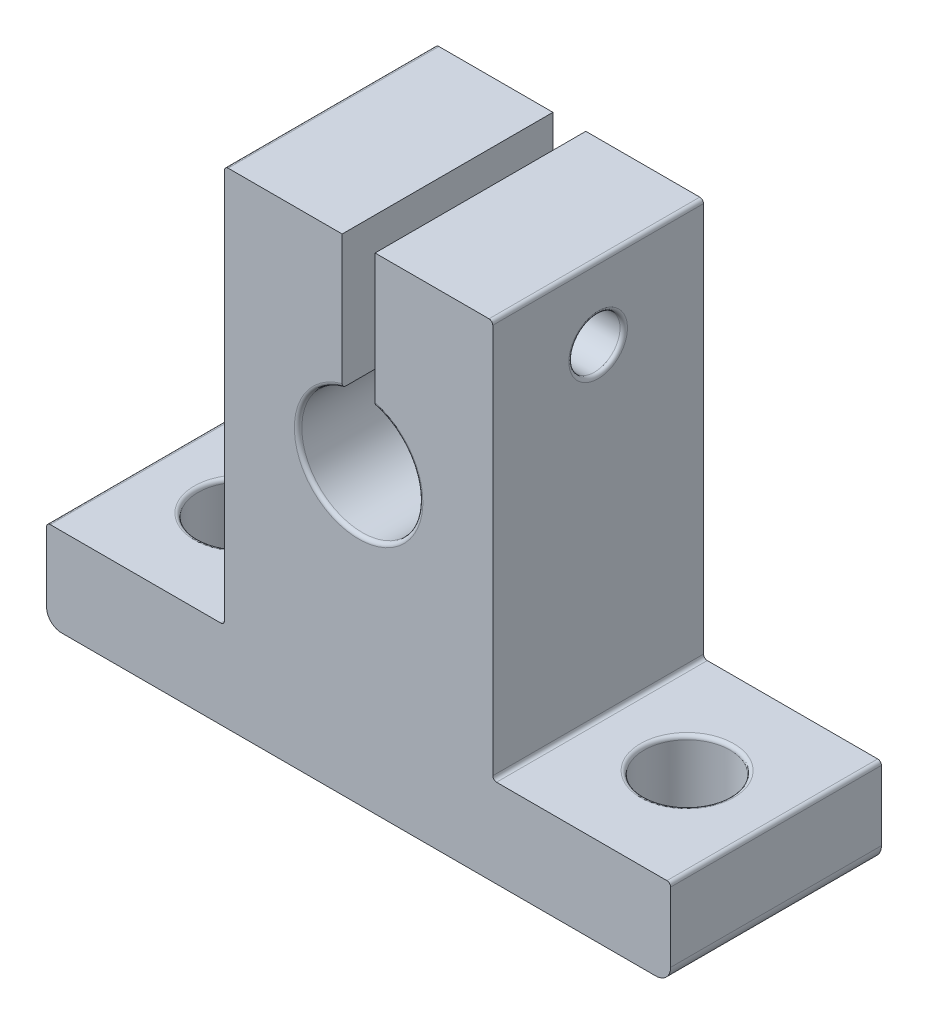
from build123d import *

# Parameters (mm, degrees)
BOSS_EXTRUDE1_DEPTH        = 7.05
MOUNTING_HOLES_REACH       = 36.54
SKETCH2_R                  = 2.875
SKETCH3_R                  = 1.71
BOLT_HOLE_DEPTH            = 45.687526224
SKETCH4_R                  = 3.675
BOLT_HEAD_DEPTH            = 3.95
HOLES_R                    = 0.25
SKETCH5_R                  = 4.075
BOLT_HEAD_INT_FILLET_DEPTH = 0.5
BOLT_HEAD_INT_FILLET_DRAFT = -45
BOTTOM_MOUNTING_R          = 0.5
BOTTOM_CORNERS_R           = 1
CORNERS_R                  = 0.25


with BuildPart() as part:
    # Sketch1 → Boss-Extrude1 (new, symmetric)
    with BuildSketch(Plane.XY):
        with BuildLine():
            Line((-20.875, 0), (20.875, 0))
            Line((20.875, 0), (20.875, 5.9))
            Line((20.875, 5.9), (8.975, 5.9))
            Line((8.975, 5.9), (8.975, 32.5))
            Line((8.975, 32.5), (1.1, 32.5))
            Line((1.1, 32.5), (1.1, 23.572755765))
            ThreePointArc((1.1, 23.572755765), (0, 15.625), (-1.1, 23.572755765))
            Line((-1.1, 23.572755765), (-1.1, 32.5))
            Line((-1.1, 32.5), (-8.975, 32.5))
            Line((-8.975, 32.5), (-8.975, 5.9))
            Line((-8.975, 5.9), (-20.875, 5.9))
            Line((-20.875, 5.9), (-20.875, 0))
        make_face()
    extrude(amount=BOSS_EXTRUDE1_DEPTH, both=True)

    # Sketch2 → Mounting Holes (cut, up to next)
    with BuildSketch(Plane(origin=(0, 5.9, 0), x_dir=(1, 0, 0), z_dir=(0, 1, 0)), mode=Mode.PRIVATE) as mounting_holes_sk1:
        with Locations((14.925, 0)):
            Circle(SKETCH2_R)
    mounting_holes_tool1 = extrude(mounting_holes_sk1.sketch, amount=-MOUNTING_HOLES_REACH, mode=Mode.PRIVATE) & part.part
    # Sketch2 → Mounting Holes (cut, up to next)
    with BuildSketch(Plane(origin=(0, 5.9, 0), x_dir=(1, 0, 0), z_dir=(0, 1, 0)), mode=Mode.PRIVATE) as mounting_holes_sk2:
        with Locations((-14.925, 0)):
            Circle(SKETCH2_R)
    mounting_holes_tool2 = extrude(mounting_holes_sk2.sketch, amount=-MOUNTING_HOLES_REACH, mode=Mode.PRIVATE) & part.part
    add(mounting_holes_tool1.solids().sort_by_distance((14.925, 5.9, 0))[0], mode=Mode.SUBTRACT)
    add(mounting_holes_tool2.solids().sort_by_distance((-14.925, 5.9, 0))[0], mode=Mode.SUBTRACT)

    # Sketch3 → Bolt Hole (cut, through all)
    with BuildSketch(Plane(origin=(8.975, 0, 0), x_dir=(0, 0, -1), z_dir=(1, 0, 0))):
        with Locations((0, 27.59)):
            Circle(SKETCH3_R)
    extrude(amount=-BOLT_HOLE_DEPTH, mode=Mode.SUBTRACT)

    # Sketch4 → Bolt Head (cut)
    with BuildSketch(Plane.ZY.offset(8.975)):
        with Locations((0, 27.59)):
            Circle(SKETCH4_R)
    extrude(amount=-BOLT_HEAD_DEPTH, mode=Mode.SUBTRACT)

    # Holes
    holes_edges = [part.edges().sort_by_distance(p)[0] for p in [
        (8.975, 27.59, 1.71),
        (-17.8, 5.9, 0),
        (12.05, 5.9, 0),
        (0, 15.625, 7.05),
        (0, 15.625, -7.05),
    ]]
    fillet(holes_edges, radius=HOLES_R)


with BuildPart() as bolt_head_int_fillet_tool:
    # Sketch5 → Bolt Head Int Fillet (with draft: the straight prism first)
    with BuildSketch(Plane.ZY.offset(8.975)):
        with Locations((0, 27.59)):
            Circle(SKETCH5_R)
    extrude(amount=-BOLT_HEAD_INT_FILLET_DEPTH)
    # Bolt Head Int Fillet: the draft: its side faces are tilted about the plane it starts from
    bolt_head_int_fillet_sides = [bolt_head_int_fillet_tool.faces().sort_by_distance(p)[0] for p in [
        (-8.725, 27.59, -4.075),
    ]]
    draft(bolt_head_int_fillet_sides, Plane.ZY.offset(8.975), BOLT_HEAD_INT_FILLET_DRAFT)


with BuildPart() as part_1:
    add(part.part)

    # Bolt Head Int Fillet: cut by bolt_head_int_fillet_tool
    add(bolt_head_int_fillet_tool.part, mode=Mode.SUBTRACT)

    # Bottom Mounting
    bottom_mounting_edges = [part_1.edges().sort_by_distance(p)[0] for p in [
        (12.05, 0, 0),
        (-17.8, 0, 0),
    ]]
    fillet(bottom_mounting_edges, radius=BOTTOM_MOUNTING_R)

    # Bottom Corners
    bottom_corners_edges = [part_1.edges().sort_by_distance(p)[0] for p in [
        (20.875, 0, 0),
        (-20.875, 0, 0),
    ]]
    fillet(bottom_corners_edges, radius=BOTTOM_CORNERS_R)

    # Corners
    corners_edges = [part_1.edges().sort_by_distance(p)[0] for p in [
        (8.975, 32.5, 0),
        (-8.975, 32.5, 0),
        (20.875, 5.9, 0),
        (8.975, 5.9, 0),
        (-8.975, 5.9, 0),
        (-20.875, 5.9, 0),
    ]]
    fillet(corners_edges, radius=CORNERS_R)


solid = part_1.part
